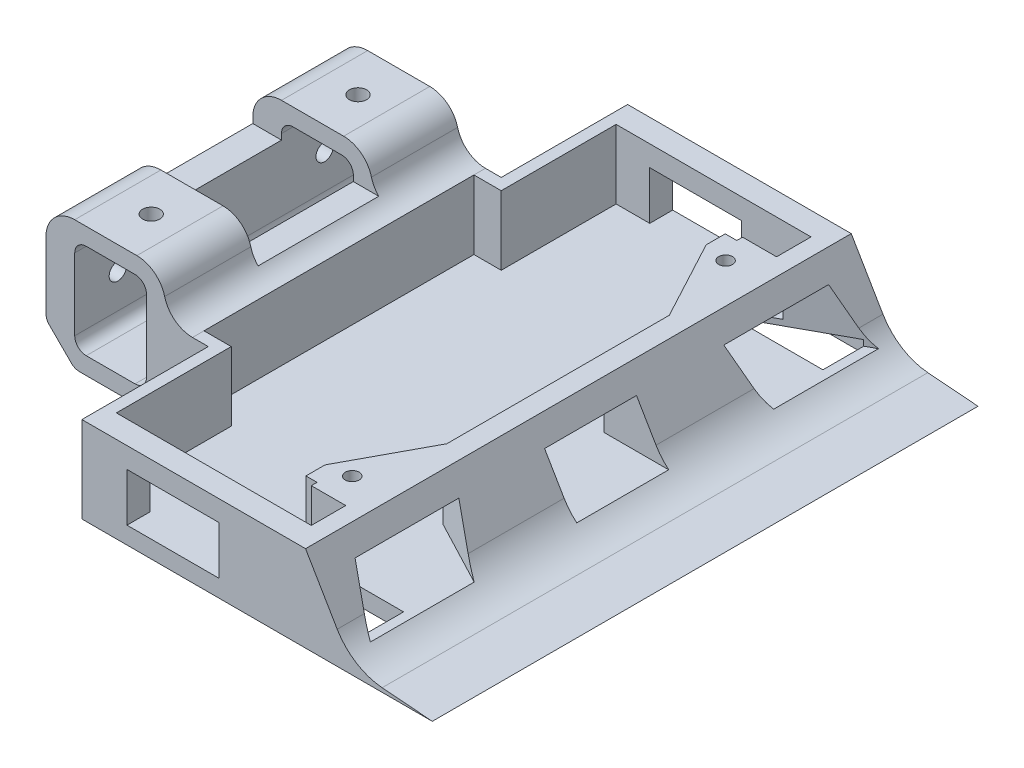
from build123d import *

# Parameters (mm, degrees)
SKETCH1_W                = 95
SKETCH1_H                = 95
BOSS_EXTRUDE1_DEPTH      = 20
SKETCH2_W                = 15
SKETCH2_H                = 8.4
CUT_EXTRUDE1_DEPTH       = 50
CUT_EXTRUDE3_DEPTH       = 100
FILLET1_R                = 10
CUT_EXTRUDE4_DEPTH       = 17
SKETCH8_W                = 15
SKETCH8_H                = 8.4
CUT_EXTRUDE5_DEPTH       = 4
SKETCH9_W                = 15
SKETCH9_H                = 8.4
CUT_EXTRUDE6_DEPTH       = 4
SKETCH10_W               = 15
SKETCH10_H               = 8.4
CUT_EXTRUDE7_DEPTH       = 100
SKETCH11_W               = 15
SKETCH11_H               = 8.4
CUT_EXTRUDE8_DEPTH       = 100
SKETCH12_W               = 96.22761595
SKETCH12_H               = 5
CUT_EXTRUDE9_DEPTH       = 100
SKETCH14_W               = 16
SKETCH14_H               = 8.4
CUT_EXTRUDE10_DEPTH      = 100
SKETCH15_W               = 16
SKETCH15_H               = 8.4
CUT_EXTRUDE11_DEPTH      = 100
SKETCH16_W               = 16
SKETCH16_H               = 8.4
CUT_EXTRUDE13_DEPTH      = 100
CUT_EXTRUDE16_DEPTH      = 12
SKETCH21_W               = 23.779532914
SKETCH21_H               = 2
BOSS_EXTRUDE2_DEPTH      = 12
SKETCH23_W               = 23.759878039
SKETCH23_H               = 2
BOSS_EXTRUDE3_DEPTH      = 12
CUT_EXTRUDE19_DEPTH      = 100
CUT_EXTRUDE19_DEPTH_BACK = 100
SKETCH24_W               = 15
SKETCH24_H               = 8.4
SKETCH26_W               = 20
SKETCH26_H               = 95
BOSS_EXTRUDE4_DEPTH      = 20
SKETCH31_W               = 95
SKETCH31_H               = 20
BOSS_EXTRUDE6_DEPTH      = 10
SKETCH32_W               = 12.5
SKETCH32_H               = 16.5
CUT_EXTRUDE22_DEPTH      = 100
SKETCH33_W               = 3.75
SKETCH33_H               = 20
CUT_EXTRUDE23_DEPTH      = 100
SKETCH34_W               = 26.25
SKETCH34_H               = 12.5
CUT_EXTRUDE24_DEPTH      = 100
SKETCH35_W               = 34
SKETCH35_H               = 47.07285681
CUT_EXTRUDE25_DEPTH      = 22
SKETCH36_W               = 34
SKETCH36_H               = 30.604426896
CUT_EXTRUDE26_DEPTH      = 22
SKETCH37_W               = 26.25
SKETCH37_H               = 21
CUT_EXTRUDE28_DEPTH      = 6
SKETCH38_W               = 5.75
SKETCH38_H               = 22.5
CUT_EXTRUDE29_DEPTH      = 100
CHAMFER1_SIZE            = 5
SKETCH39_W               = 2.070576792
SKETCH39_H               = 87
CUT_EXTRUDE30_DEPTH      = 12
FILLET4_R                = 5
FILLET5_R                = 5
SKETCH40_W               = 4.75
SKETCH40_H               = 47
CUT_EXTRUDE31_DEPTH      = 12
FILLET6_R                = 5
SKETCH46_W               = 17
SKETCH46_H               = 9
CUT_EXTRUDE36_DEPTH      = 4
SKETCH47_R               = 1.25
CUT_EXTRUDE37_DEPTH      = 100
SKETCH48_W               = 6
SKETCH48_H               = 6
CUT_EXTRUDE40_DEPTH      = 10
SKETCH49_W               = 2.104185464
SKETCH49_H               = 6
SKETCH49_W_2             = 2.084530589
CUT_EXTRUDE41_DEPTH      = 20
SKETCH50_W               = 3
SKETCH50_H               = 9
CUT_EXTRUDE42_DEPTH      = 20
SKETCH51_W               = 3
SKETCH51_H               = 15
BOSS_EXTRUDE7_DEPTH      = 2
SKETCH52_W               = 3
SKETCH52_H               = 15
BOSS_EXTRUDE8_DEPTH      = 2
SKETCH53_W               = 12.334968933
SKETCH53_H               = 76.062556776
CUT_EXTRUDE43_DEPTH      = 12
SKETCH54_W               = 1.934640295
SKETCH54_H               = 1
CUT_EXTRUDE44_DEPTH      = 20
SKETCH55_W               = 2.010606447
SKETCH55_H               = 1
CUT_EXTRUDE45_DEPTH      = 20
SKETCH56_R               = 1.5
CUT_EXTRUDE46_DEPTH      = 10
SKETCH57_R               = 1.5
CUT_EXTRUDE47_DEPTH      = 10
FILLET11_R               = 2
SKETCH58_R               = 1.2
CUT_EXTRUDE48_DEPTH      = 10
SKETCH59_W               = 16
SKETCH59_H               = 8.4
CUT_EXTRUDE49_DEPTH      = 9090
FILLET14_R               = 2
FILLET15_R               = 2
FILLET16_R               = 2
FILLET17_R               = 2
FILLET18_R               = 2


with BuildPart() as part:
    # Sketch1 → Boss-Extrude1 (new body)
    with BuildSketch(Plane(origin=(0, 0, 0), x_dir=(1, 0, 0), z_dir=(0, 1, 0))):
        with Locations((-2.165031067, 2.677660124)):
            Rectangle(SKETCH1_W, SKETCH1_H)
    extrude(amount=BOSS_EXTRUDE1_DEPTH)

    # Sketch2 → Cut-Extrude1 (cut)
    with BuildSketch(Plane(origin=(45.334968933, 0, 0), x_dir=(0, 0, -1), z_dir=(1, 0, 0))):
        with Locations((2.677660124, 7.2)):
            Rectangle(SKETCH2_W, SKETCH2_H)
    extrude(amount=-CUT_EXTRUDE1_DEPTH, mode=Mode.SUBTRACT)

    # Sketch6 → Cut-Extrude3 (cut)
    with BuildSketch(Plane.XY.offset(44.822339876)):
        Polygon((45.334968933, 0), (31.416327077, 1.119733542), (20.334968933, 20), (45.334968933, 20), align=None)
    extrude(amount=-CUT_EXTRUDE3_DEPTH, mode=Mode.SUBTRACT)

    # Fillet1
    # the kernel refuses this fillet: 10 mm, written as the material it adds along each edge
    with BuildSketch(Plane(origin=(31.416327077, 1.119733542, 44.822339876), x_dir=(0.9967796443594351, -0.08018940447888392, 0), z_dir=(0, 0, -1))) as fillet1_piece_1_section:
        with BuildLine():
            CenterArc((FILLET1_R * 0.52046366993, -FILLET1_R), FILLET1_R, 90, 54.990678882)
            Line((-FILLET1_R * 0.298595051697, -FILLET1_R * 0.426290308146), (0, 0))
            Line((0, 0), (FILLET1_R * 0.52046366993, 0))
        make_face()
    fillet1_piece_1 = extrude(amount=95, mode=Mode.PRIVATE)
    fillet1_piece_1 = split(fillet1_piece_1, bisect_by=Plane(origin=(32.462514907, 1.548685907, 4.822339876), z_dir=(0, 0, 1)), keep=Keep.TOP, mode=Mode.PRIVATE)
    fillet1_piece_1 = split(fillet1_piece_1, bisect_by=Plane(origin=(32.462514907, 3, 24.822339876), z_dir=(0, -1, 0)), keep=Keep.TOP, mode=Mode.PRIVATE)
    add(fillet1_piece_1)
    with BuildSketch(Plane(origin=(31.416327077, 1.119733542, 44.822339876), x_dir=(0.9967796443594351, -0.08018940447888392, 0), z_dir=(0, 0, -1))) as fillet1_piece_2_section:
        with BuildLine():
            CenterArc((FILLET1_R * 0.52046366993, -FILLET1_R), FILLET1_R, 90, 54.990678882)
            Line((-FILLET1_R * 0.298595051697, -FILLET1_R * 0.426290308146), (0, 0))
            Line((0, 0), (FILLET1_R * 0.52046366993, 0))
        make_face()
    fillet1_piece_2 = extrude(amount=95, mode=Mode.PRIVATE)
    fillet1_piece_2 = split(fillet1_piece_2, bisect_by=Plane(origin=(29.780943428, 3.965739863, 4.822339876), z_dir=(0, 0, 1)), keep=Keep.TOP, mode=Mode.PRIVATE)
    fillet1_piece_2 = split(fillet1_piece_2, bisect_by=Plane(origin=(29.780943428, 3, 24.822339876), z_dir=(0, 1, 0)), keep=Keep.TOP, mode=Mode.PRIVATE)
    add(fillet1_piece_2)
    with BuildSketch(Plane(origin=(31.416327077, 1.119733542, 44.822339876), x_dir=(0.9967796443594351, -0.08018940447888392, 0), z_dir=(0, 0, -1))) as fillet1_piece_3_section:
        with BuildLine():
            CenterArc((FILLET1_R * 0.52046366993, -FILLET1_R), FILLET1_R, 90, 54.990678882)
            Line((-FILLET1_R * 0.298595051697, -FILLET1_R * 0.426290308146), (0, 0))
            Line((0, 0), (FILLET1_R * 0.52046366993, 0))
        make_face()
    fillet1_piece_3 = extrude(amount=95, mode=Mode.PRIVATE)
    fillet1_piece_3 = split(fillet1_piece_3, bisect_by=Plane(origin=(32.462514907, 1.548685907, -10.177660124), z_dir=(0, 0, 1)), keep=Keep.TOP, mode=Mode.PRIVATE)
    fillet1_piece_3 = split(fillet1_piece_3, bisect_by=Plane(origin=(32.462514907, 1.548685907, 4.822339876), z_dir=(0, 0, -1)), keep=Keep.TOP, mode=Mode.PRIVATE)
    fillet1_piece_3 = split(fillet1_piece_3, bisect_by=Plane(origin=(32.462514907, 3, -2.677660124), z_dir=(0, -1, 0)), keep=Keep.TOP, mode=Mode.PRIVATE)
    add(fillet1_piece_3)
    with BuildSketch(Plane(origin=(31.416327077, 1.119733542, 44.822339876), x_dir=(0.9967796443594351, -0.08018940447888392, 0), z_dir=(0, 0, -1))) as fillet1_piece_4_section:
        with BuildLine():
            CenterArc((FILLET1_R * 0.52046366993, -FILLET1_R), FILLET1_R, 90, 54.990678882)
            Line((-FILLET1_R * 0.298595051697, -FILLET1_R * 0.426290308146), (0, 0))
            Line((0, 0), (FILLET1_R * 0.52046366993, 0))
        make_face()
    fillet1_piece_4 = extrude(amount=95, mode=Mode.PRIVATE)
    fillet1_piece_4 = split(fillet1_piece_4, bisect_by=Plane(origin=(32.462514907, 1.548685907, -10.177660124), z_dir=(0, 0, -1)), keep=Keep.TOP, mode=Mode.PRIVATE)
    fillet1_piece_4 = split(fillet1_piece_4, bisect_by=Plane(origin=(32.462514907, 3, -30.177660124), z_dir=(0, -1, 0)), keep=Keep.TOP, mode=Mode.PRIVATE)
    add(fillet1_piece_4)
    with BuildSketch(Plane(origin=(31.416327077, 1.119733542, 44.822339876), x_dir=(0.9967796443594351, -0.08018940447888392, 0), z_dir=(0, 0, -1))) as fillet1_piece_5_section:
        with BuildLine():
            CenterArc((FILLET1_R * 0.52046366993, -FILLET1_R), FILLET1_R, 90, 54.990678882)
            Line((-FILLET1_R * 0.298595051697, -FILLET1_R * 0.426290308146), (0, 0))
            Line((0, 0), (FILLET1_R * 0.52046366993, 0))
        make_face()
    fillet1_piece_5 = extrude(amount=95, mode=Mode.PRIVATE)
    fillet1_piece_5 = split(fillet1_piece_5, bisect_by=Plane(origin=(29.780943428, 3.965739863, -10.177660124), z_dir=(0, 0, -1)), keep=Keep.TOP, mode=Mode.PRIVATE)
    fillet1_piece_5 = split(fillet1_piece_5, bisect_by=Plane(origin=(29.780943428, 3, -30.177660124), z_dir=(0, 1, 0)), keep=Keep.TOP, mode=Mode.PRIVATE)
    add(fillet1_piece_5)

    # Sketch7 → Cut-Extrude4 (cut)
    with BuildSketch(Plane(origin=(0, 20, 0), x_dir=(1, 0, 0), z_dir=(0, 1, 0))):
        Polygon((11.360713437, -29.822339876), (18.334968933, -16.542288661), (9.481601456, -11.892784997), (2.50734596, -25.172836212), align=None)
        Polygon((18.334968933, 22.020257336), (11.132000664, 35.177660124), (2.360398805, 30.375681278), (9.563367074, 17.21827849), align=None)
    extrude(amount=-CUT_EXTRUDE4_DEPTH, mode=Mode.SUBTRACT)

    # Sketch8 → Cut-Extrude5 (cut)
    with BuildSketch(Plane(origin=(12.327397833, 0, 6.473952599), x_dir=(0.4649503663833249, 0, -0.885336747684186), z_dir=(0.8853367476841859, 0, 0.4649503663833248))):
        with Locations((-13.620645519, 7.2)):
            Rectangle(SKETCH8_W, SKETCH8_H)
    extrude(amount=-CUT_EXTRUDE5_DEPTH, mode=Mode.SUBTRACT)

    # Sketch9 → Cut-Extrude6 (cut)
    with BuildSketch(Plane(origin=(14.610669282, 0, -7.99855328), x_dir=(-0.48019788460400603, 0, -0.8771601858394155), z_dir=(0.8771601858394155, 0, -0.48019788460400603))):
        with Locations((18.010879722, 7.2)):
            Rectangle(SKETCH9_W, SKETCH9_H)
    extrude(amount=-CUT_EXTRUDE6_DEPTH, mode=Mode.SUBTRACT)

    # Sketch10 → Cut-Extrude7 (cut)
    with BuildSketch(Plane(origin=(8.786050842, 0, 4.614151134), x_dir=(0.464950366383325, 0, -0.8853367476841859), z_dir=(0.8853367476841859, 0, 0.464950366383325))):
        with Locations((-13.620645519, 7.2)):
            Rectangle(SKETCH10_W, SKETCH10_H)
    extrude(amount=CUT_EXTRUDE7_DEPTH, mode=Mode.SUBTRACT)

    # Sketch11 → Cut-Extrude8 (cut)
    with BuildSketch(Plane(origin=(11.102028539, 0, -6.077761742), x_dir=(-0.48019788460400603, 0, -0.8771601858394155), z_dir=(0.8771601858394155, 0, -0.48019788460400603))):
        with Locations((18.010879722, 7.2)):
            Rectangle(SKETCH11_W, SKETCH11_H)
    extrude(amount=CUT_EXTRUDE8_DEPTH, mode=Mode.SUBTRACT)

    # Sketch12 → Cut-Extrude9 (cut)
    with BuildSketch(Plane.XY.offset(44.822339876)):
        with Locations((-1.551223092, 17.5)):
            Rectangle(SKETCH12_W, SKETCH12_H)
    extrude(amount=-CUT_EXTRUDE9_DEPTH, mode=Mode.SUBTRACT)

    # Sketch14 → Cut-Extrude10 (cut)
    with BuildSketch(Plane(origin=(11.102028539, 0, -6.077761742), x_dir=(-0.48019788460400603, 0, -0.8771601858394155), z_dir=(0.8771601858394155, 0, -0.48019788460400603))):
        with Locations((18.510879722, 7.2)):
            Rectangle(SKETCH14_W, SKETCH14_H)
    extrude(amount=CUT_EXTRUDE10_DEPTH, mode=Mode.SUBTRACT)

    # Sketch15 → Cut-Extrude11 (cut)
    with BuildSketch(Plane(origin=(8.786050842, 0, 4.614151134), x_dir=(0.464950366383325, 0, -0.8853367476841859), z_dir=(0.8853367476841859, 0, 0.464950366383325))):
        with Locations((-14.120645519, 7.2)):
            Rectangle(SKETCH15_W, SKETCH15_H)
    extrude(amount=CUT_EXTRUDE11_DEPTH, mode=Mode.SUBTRACT)

    # Sketch16 → Cut-Extrude13 (cut)
    with BuildSketch(Plane(origin=(-4.665031067, 0, 0), x_dir=(0, 0, -1), z_dir=(1, 0, 0))):
        with Locations((2.677660124, 7.2)):
            Rectangle(SKETCH16_W, SKETCH16_H)
    extrude(amount=CUT_EXTRUDE13_DEPTH, mode=Mode.SUBTRACT)

    # Sketch19 → Cut-Extrude16 (cut)
    with BuildSketch(Plane(origin=(0, 15, 0), x_dir=(1, 0, 0), z_dir=(0, 1, 0))):
        Polygon((12.165423764, -30.809704699), (19.747212292, -16.720116958), (19.744163962, 22.025988312), (12.185078639, 36.127769372), (12.185078639, 48.177660124), (-11.594454275, 48.177660124), (-11.594454275, -42.822339876), (12.165423764, -42.822339876), align=None)
    extrude(amount=-CUT_EXTRUDE16_DEPTH, mode=Mode.SUBTRACT)

    # Sketch21 → Boss-Extrude2 (add)
    with BuildSketch(Plane(origin=(0, 3, 0), x_dir=(1, 0, 0), z_dir=(0, 1, 0))):
        with Locations((0.295312182, 47.177660124)):
            Rectangle(SKETCH21_W, SKETCH21_H)
    extrude(amount=BOSS_EXTRUDE2_DEPTH)

    # Sketch23 → Boss-Extrude3 (add)
    with BuildSketch(Plane(origin=(0, 3, 0), x_dir=(1, 0, 0), z_dir=(0, 1, 0))):
        with Locations((0.285484745, -41.822339876)):
            Rectangle(SKETCH23_W, SKETCH23_H)
    extrude(amount=BOSS_EXTRUDE3_DEPTH)

    # Sketch24 → Cut-Extrude19 (cut, two sides: drawn at the far end of the back side and taken through both)
    with BuildSketch(Plane.XY.offset(-46.177660124).offset(-CUT_EXTRUDE19_DEPTH_BACK)):
        with Locations((-0.314454275, 7.2)):
            Rectangle(SKETCH24_W, SKETCH24_H)
    extrude(amount=CUT_EXTRUDE19_DEPTH + CUT_EXTRUDE19_DEPTH_BACK, mode=Mode.SUBTRACT)

    # Sketch26 → Boss-Extrude4 (add)
    with BuildSketch(Plane(origin=(0, 15, 0), x_dir=(1, 0, 0), z_dir=(0, 1, 0))):
        with Locations((-39.665031067, 2.677660124)):
            Rectangle(SKETCH26_W, SKETCH26_H)
    extrude(amount=BOSS_EXTRUDE4_DEPTH)

    # Sketch31 → Boss-Extrude6 (add)
    with BuildSketch(Plane(origin=(-29.665031067, 0, 0), x_dir=(0, 0, -1), z_dir=(1, 0, 0))):
        with Locations((2.677660124, 25)):
            Rectangle(SKETCH31_W, SKETCH31_H)
    extrude(amount=BOSS_EXTRUDE6_DEPTH)

    # Sketch32 → Cut-Extrude22 (cut)
    with BuildSketch(Plane(origin=(0, 0, -50.177660124), x_dir=(-1, 0, 0), z_dir=(0, 0, -1))):
        with Locations((32.665031067, 11.25)):
            Rectangle(SKETCH32_W, SKETCH32_H)
    extrude(amount=-CUT_EXTRUDE22_DEPTH, mode=Mode.SUBTRACT)

    # Sketch33 → Cut-Extrude23 (cut)
    with BuildSketch(Plane(origin=(0, 0, -50.177660124), x_dir=(-1, 0, 0), z_dir=(0, 0, -1))):
        with Locations((21.540031067, 25)):
            Rectangle(SKETCH33_W, SKETCH33_H)
    extrude(amount=-CUT_EXTRUDE23_DEPTH, mode=Mode.SUBTRACT)

    # Sketch34 → Cut-Extrude24 (cut)
    with BuildSketch(Plane(origin=(0, 0, -50.177660124), x_dir=(-1, 0, 0), z_dir=(0, 0, -1))):
        with Locations((36.540031067, 28.75)):
            Rectangle(SKETCH34_W, SKETCH34_H)
    extrude(amount=-CUT_EXTRUDE24_DEPTH, mode=Mode.SUBTRACT)

    # Sketch35 → Cut-Extrude25 (cut)
    with BuildSketch(Plane(origin=(0, 0, -50.177660124), x_dir=(-1, 0, 0), z_dir=(0, 0, -1))):
        with Locations((32.665031067, 23.536428405)):
            Rectangle(SKETCH35_W, SKETCH35_H)
    extrude(amount=-CUT_EXTRUDE25_DEPTH, mode=Mode.SUBTRACT)

    # Sketch36 → Cut-Extrude26 (cut)
    with BuildSketch(Plane.XY.offset(44.822339876)):
        with Locations((-32.665031067, 15.302213448)):
            Rectangle(SKETCH36_W, SKETCH36_H)
    extrude(amount=-CUT_EXTRUDE26_DEPTH, mode=Mode.SUBTRACT)

    # Sketch37 → Cut-Extrude28 (cut)
    with BuildSketch(Plane(origin=(0, 22.5, 0), x_dir=(1, 0, 0), z_dir=(0, 1, 0))):
        with Locations((-36.540031067, 2.677660124)):
            Rectangle(SKETCH37_W, SKETCH37_H)
    extrude(amount=-CUT_EXTRUDE28_DEPTH, mode=Mode.SUBTRACT)

    # Sketch38 → Cut-Extrude29 (cut)
    with BuildSketch(Plane.XY.offset(22.822339876)):
        with Locations((-46.790031067, 11.25)):
            Rectangle(SKETCH38_W, SKETCH38_H)
    extrude(amount=-CUT_EXTRUDE29_DEPTH, mode=Mode.SUBTRACT)

    # Chamfer1
    chamfer1_edges = [part.edges().sort_by_distance(p)[0] for p in [
        (-43.915031067, 0, -2.677660124),
    ]]
    chamfer(chamfer1_edges, length=CHAMFER1_SIZE)

    # Sketch39 → Cut-Extrude30 (cut)
    with BuildSketch(Plane(origin=(0, 15, 0), x_dir=(1, 0, 0), z_dir=(0, 1, 0))):
        with Locations((-12.629742671, 2.677660124)):
            Rectangle(SKETCH39_W, SKETCH39_H)
    extrude(amount=-CUT_EXTRUDE30_DEPTH, mode=Mode.SUBTRACT)

    # Fillet4
    # the kernel refuses this fillet: 5 mm, written as the material it adds along each edge
    with BuildSketch(Plane(origin=(-23.415031067, 15, -28.177660124), x_dir=(1, 0, 0), z_dir=(0, 0, 1))) as fillet4_piece_1_section:
        with BuildLine():
            CenterArc((FILLET4_R, FILLET4_R), FILLET4_R, 180, 90)
            Line((0, FILLET4_R), (0, 0))
            Line((0, 0), (FILLET4_R, 0))
        make_face()
    fillet4_piece_1 = extrude(amount=51, mode=Mode.PRIVATE)
    fillet4_piece_1 = split(fillet4_piece_1, bisect_by=Plane(origin=(-21.940460429, 15.541584114, -13.177660124), z_dir=(0, 0, -1)), keep=Keep.TOP, mode=Mode.PRIVATE)
    fillet4_piece_1 = split(fillet4_piece_1, bisect_by=Plane(origin=(-21.940460429, 16.5, -20.677660124), z_dir=(0, -1, 0)), keep=Keep.TOP, mode=Mode.PRIVATE)
    add(fillet4_piece_1)
    with BuildSketch(Plane(origin=(-23.415031067, 15, -28.177660124), x_dir=(1, 0, 0), z_dir=(0, 0, 1))) as fillet4_piece_2_section:
        with BuildLine():
            CenterArc((FILLET4_R, FILLET4_R), FILLET4_R, 180, 90)
            Line((0, FILLET4_R), (0, 0))
            Line((0, 0), (FILLET4_R, 0))
        make_face()
    fillet4_piece_2 = extrude(amount=51, mode=Mode.PRIVATE)
    fillet4_piece_2 = split(fillet4_piece_2, bisect_by=Plane(origin=(-23.084676974, 17.513403735, -13.177660124), z_dir=(0, 0, -1)), keep=Keep.TOP, mode=Mode.PRIVATE)
    fillet4_piece_2 = split(fillet4_piece_2, bisect_by=Plane(origin=(-23.084676974, 16.5, -20.677660124), z_dir=(0, 1, 0)), keep=Keep.TOP, mode=Mode.PRIVATE)
    add(fillet4_piece_2)
    with BuildSketch(Plane(origin=(-23.415031067, 15, -28.177660124), x_dir=(1, 0, 0), z_dir=(0, 0, 1))) as fillet4_piece_3_section:
        with BuildLine():
            CenterArc((FILLET4_R, FILLET4_R), FILLET4_R, 180, 90)
            Line((0, FILLET4_R), (0, 0))
            Line((0, 0), (FILLET4_R, 0))
        make_face()
    fillet4_piece_3 = extrude(amount=51, mode=Mode.PRIVATE)
    fillet4_piece_3 = split(fillet4_piece_3, bisect_by=Plane(origin=(-21.940460429, 15.541584114, -13.177660124), z_dir=(0, 0, 1)), keep=Keep.TOP, mode=Mode.PRIVATE)
    fillet4_piece_3 = split(fillet4_piece_3, bisect_by=Plane(origin=(-21.940460429, 16.5, -2.677660124), z_dir=(0, -1, 0)), keep=Keep.TOP, mode=Mode.PRIVATE)
    fillet4_piece_3 = split(fillet4_piece_3, bisect_by=Plane(origin=(-21.940460429, 15.541584114, 7.822339876), z_dir=(0, 0, -1)), keep=Keep.TOP, mode=Mode.PRIVATE)
    add(fillet4_piece_3)
    with BuildSketch(Plane(origin=(-23.415031067, 15, -28.177660124), x_dir=(1, 0, 0), z_dir=(0, 0, 1))) as fillet4_piece_4_section:
        with BuildLine():
            CenterArc((FILLET4_R, FILLET4_R), FILLET4_R, 180, 90)
            Line((0, FILLET4_R), (0, 0))
            Line((0, 0), (FILLET4_R, 0))
        make_face()
    fillet4_piece_4 = extrude(amount=51, mode=Mode.PRIVATE)
    fillet4_piece_4 = split(fillet4_piece_4, bisect_by=Plane(origin=(-21.940460429, 16.5, 15.322339876), z_dir=(0, -1, 0)), keep=Keep.TOP, mode=Mode.PRIVATE)
    fillet4_piece_4 = split(fillet4_piece_4, bisect_by=Plane(origin=(-21.940460429, 15.541584114, 7.822339876), z_dir=(0, 0, 1)), keep=Keep.TOP, mode=Mode.PRIVATE)
    add(fillet4_piece_4)
    with BuildSketch(Plane(origin=(-23.415031067, 15, -28.177660124), x_dir=(1, 0, 0), z_dir=(0, 0, 1))) as fillet4_piece_5_section:
        with BuildLine():
            CenterArc((FILLET4_R, FILLET4_R), FILLET4_R, 180, 90)
            Line((0, FILLET4_R), (0, 0))
            Line((0, 0), (FILLET4_R, 0))
        make_face()
    fillet4_piece_5 = extrude(amount=51, mode=Mode.PRIVATE)
    fillet4_piece_5 = split(fillet4_piece_5, bisect_by=Plane(origin=(-23.084676974, 16.5, 15.322339876), z_dir=(0, 1, 0)), keep=Keep.TOP, mode=Mode.PRIVATE)
    fillet4_piece_5 = split(fillet4_piece_5, bisect_by=Plane(origin=(-23.084676974, 17.513403735, 7.822339876), z_dir=(0, 0, 1)), keep=Keep.TOP, mode=Mode.PRIVATE)
    add(fillet4_piece_5)

    # Fillet5
    fillet5_edges = [part.edges().sort_by_distance(p)[0] for p in [
        (-23.415031067, 22.5, 15.322339876),
        (-23.415031067, 22.5, -20.677660124),
    ]]
    fillet(fillet5_edges, radius=FILLET5_R)

    # Sketch40 → Cut-Extrude31 (cut)
    with BuildSketch(Plane(origin=(0, 15, 0), x_dir=(1, 0, 0), z_dir=(0, 1, 0))):
        with Locations((-16.040031067, 2.677660124)):
            Rectangle(SKETCH40_W, SKETCH40_H)
    extrude(amount=-CUT_EXTRUDE31_DEPTH, mode=Mode.SUBTRACT)

    # Fillet6
    fillet6_edges = [part.edges().sort_by_distance(p)[0] for p in [
        (-43.915031067, 22.5, -20.677660124),
        (-43.915031067, 22.5, 15.322339876),
    ]]
    fillet(fillet6_edges, radius=FILLET6_R)

    # Sketch46 → Cut-Extrude36 (cut)
    with BuildSketch(Plane(origin=(0, 0, 0), x_dir=(-1, 0, 0), z_dir=(0, -1, 0))):
        with Locations((-20.834968933, -38.322339876)):
            Rectangle(SKETCH46_W, SKETCH46_H)
        with Locations((-20.834968933, 43.677660124)):
            Rectangle(SKETCH46_W, SKETCH46_H)
    extrude(amount=-CUT_EXTRUDE36_DEPTH, mode=Mode.SUBTRACT)

    # Sketch47 → Cut-Extrude37 (cut)
    with BuildSketch(Plane(origin=(0, 4, 0), x_dir=(-1, 0, 0), z_dir=(0, -1, 0))):
        with Locations(Location((-17.334968933, -38.322339876, 0), (0, 0, 90))):
            Circle(SKETCH47_R)
        with Locations(Location((-17.334968933, 43.677660124, 0), (0, 0, 90))):
            Circle(SKETCH47_R)
    extrude(amount=-CUT_EXTRUDE37_DEPTH, mode=Mode.SUBTRACT)

    # Sketch48 → Cut-Extrude40 (cut)
    with BuildSketch(Plane(origin=(0, 15, 0), x_dir=(1, 0, 0), z_dir=(0, 1, 0))):
        with Locations((17.269609228, -37.822339876)):
            Rectangle(SKETCH48_W, SKETCH48_H)
        with Locations((17.269609228, 43.177660124)):
            Rectangle(SKETCH48_W, SKETCH48_H)
    extrude(amount=-CUT_EXTRUDE40_DEPTH, mode=Mode.SUBTRACT)

    # Sketch49 → Cut-Extrude41 (cut)
    with BuildSketch(Plane(origin=(0, 15, 0), x_dir=(1, 0, 0), z_dir=(0, 1, 0))):
        with Locations((13.217516496, -37.822339876)):
            Rectangle(SKETCH49_W, SKETCH49_H)
        with Locations((13.227343934, 43.177660124)):
            Rectangle(SKETCH49_W_2, SKETCH49_H)
    extrude(amount=-CUT_EXTRUDE41_DEPTH, mode=Mode.SUBTRACT)

    # Sketch50 → Cut-Extrude42 (cut)
    with BuildSketch(Plane(origin=(0, 0, 0), x_dir=(-1, 0, 0), z_dir=(0, -1, 0))):
        with Locations((-10.834968933, -38.322339876)):
            Rectangle(SKETCH50_W, SKETCH50_H)
        with Locations((-10.834968933, 43.677660124)):
            Rectangle(SKETCH50_W, SKETCH50_H)
    extrude(amount=-CUT_EXTRUDE42_DEPTH, mode=Mode.SUBTRACT)

    # Sketch51 → Boss-Extrude7 (add)
    with BuildSketch(Plane(origin=(0, 0, 42.822339876), x_dir=(-1, 0, 0), z_dir=(0, 0, -1))):
        with Locations((-10.834968933, 7.5)):
            Rectangle(SKETCH51_W, SKETCH51_H)
    extrude(amount=BOSS_EXTRUDE7_DEPTH)

    # Sketch52 → Boss-Extrude8 (add)
    with BuildSketch(Plane.XY.offset(-48.177660124)):
        with Locations((10.834968933, 7.5)):
            Rectangle(SKETCH52_W, SKETCH52_H)
    extrude(amount=BOSS_EXTRUDE8_DEPTH)

    # Sketch53 → Cut-Extrude43 (cut)
    with BuildSketch(Plane(origin=(0, 15, 0), x_dir=(1, 0, 0), z_dir=(0, 1, 0))):
        with Locations((6.167484467, 3.208938512)):
            Rectangle(SKETCH53_W, SKETCH53_H)
    extrude(amount=-CUT_EXTRUDE43_DEPTH, mode=Mode.SUBTRACT)

    # Sketch54 → Cut-Extrude44 (cut)
    with BuildSketch(Plane(origin=(0, 4, 0), x_dir=(-1, 0, 0), z_dir=(0, -1, 0))):
        with Locations((-13.30228908, -34.322339876)):
            Rectangle(SKETCH54_W, SKETCH54_H)
    extrude(amount=-CUT_EXTRUDE44_DEPTH, mode=Mode.SUBTRACT)

    # Sketch55 → Cut-Extrude45 (cut)
    with BuildSketch(Plane(origin=(0, 4, 0), x_dir=(-1, 0, 0), z_dir=(0, -1, 0))):
        with Locations((-13.340272157, 39.677660124)):
            Rectangle(SKETCH55_W, SKETCH55_H)
    extrude(amount=-CUT_EXTRUDE45_DEPTH, mode=Mode.SUBTRACT)

    # Sketch56 → Cut-Extrude46 (cut)
    with BuildSketch(Plane(origin=(0, 22.5, 0), x_dir=(1, 0, 0), z_dir=(0, 1, 0))):
        with Locations(Location((-33.097489433, -15.322339876, 0), (0, 0, 270))):
            Circle(SKETCH56_R)
        with Locations(Location((-33.097489433, 20.677660124, 0), (0, 0, 270))):
            Circle(SKETCH56_R)
    extrude(amount=-CUT_EXTRUDE46_DEPTH, mode=Mode.SUBTRACT)

    # Sketch57 → Cut-Extrude47 (cut)
    with BuildSketch(Plane.ZY.offset(43.915031067)):
        with Locations((-20.677660124, 11)):
            Circle(SKETCH57_R)
        with Locations((15.322339876, 11)):
            Circle(SKETCH57_R)
    extrude(amount=-CUT_EXTRUDE47_DEPTH, mode=Mode.SUBTRACT)

    # Fillet11
    fillet11_edges = [part.edges().sort_by_distance(p)[0] for p in [
        (-43.915031067, 5, -2.677660124),
        (-38.915031067, 0, -2.677660124),
    ]]
    fillet(fillet11_edges, radius=FILLET11_R)

    # Sketch58 → Cut-Extrude48 (cut)
    with BuildSketch(Plane(origin=(0, 15, 0), x_dir=(1, 0, 0), z_dir=(0, 1, 0))):
        with Locations(Location((16.395035096, 35.177660124, 0), (0, 0, 270))):
            Circle(SKETCH58_R)
        with Locations(Location((16.395035096, -29.822339876, 0), (0, 0, 270))):
            Circle(SKETCH58_R)
    extrude(amount=-CUT_EXTRUDE48_DEPTH, mode=Mode.SUBTRACT)

    # Sketch59 → Cut-Extrude49 (cut)
    with BuildSketch(Plane.XY.offset(44.822339876)):
        with Locations((0.185545725, 7.2)):
            Rectangle(SKETCH59_W, SKETCH59_H)
    extrude(amount=-CUT_EXTRUDE49_DEPTH, mode=Mode.SUBTRACT)

    # Fillet14
    fillet14_edges = [part.edges().sort_by_distance(p)[0] for p in [
        (-26.415031067, 3, -2.677660124),
        (-38.915031067, 3, -2.677660124),
    ]]
    fillet(fillet14_edges, radius=FILLET14_R)

    # Fillet15
    fillet15_edges = [part.edges().sort_by_distance(p)[0] for p in [
        (-38.915031067, 19.5, 15.322339876),
    ]]
    fillet(fillet15_edges, radius=FILLET15_R)

    # Fillet16
    fillet16_edges = [part.edges().sort_by_distance(p)[0] for p in [
        (-38.915031067, 19.5, -20.677660124),
    ]]
    fillet(fillet16_edges, radius=FILLET16_R)

    # Fillet17
    fillet17_edges = [part.edges().sort_by_distance(p)[0] for p in [
        (-26.415031067, 19.5, 15.322339876),
    ]]
    fillet(fillet17_edges, radius=FILLET17_R)

    # Fillet18
    fillet18_edges = [part.edges().sort_by_distance(p)[0] for p in [
        (-26.415031067, 19.5, -20.677660124),
    ]]
    fillet(fillet18_edges, radius=FILLET18_R)


solid = part.part
